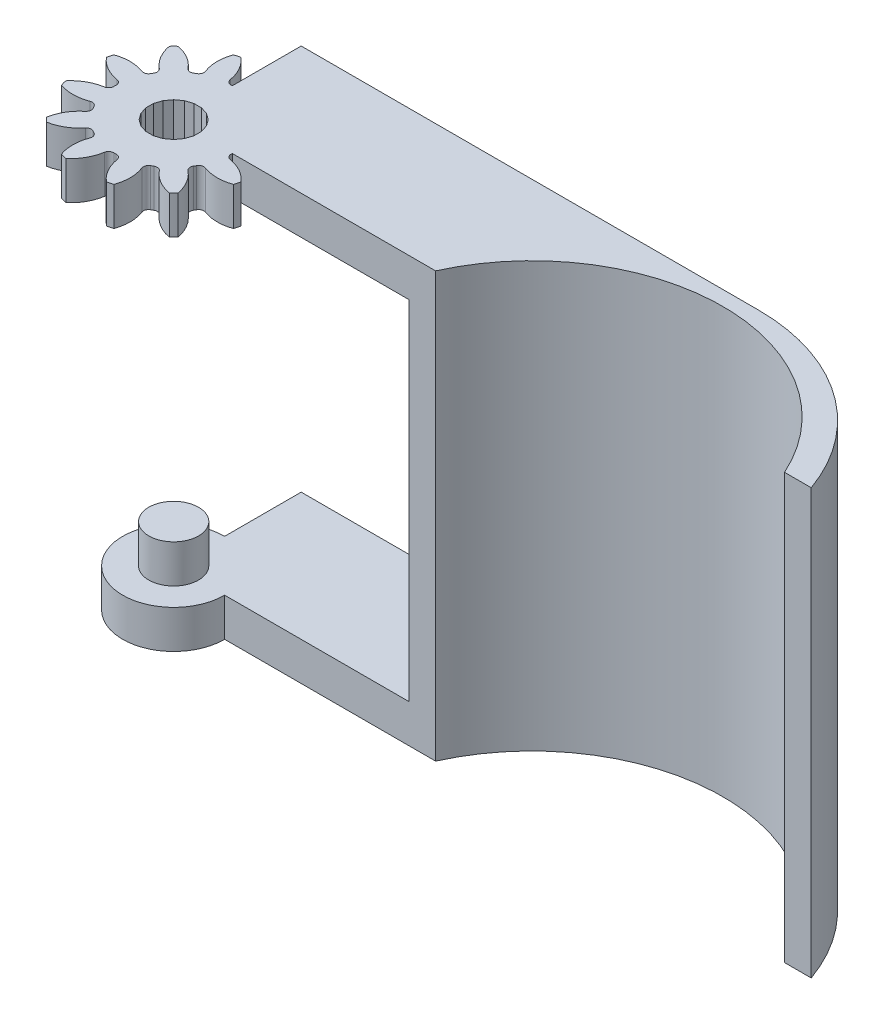
from build123d import *

# Parameters (mm, degrees)
SKETCH1_W           = 50
SKETCH1_H           = 10
BOSS_EXTRUDE2_DEPTH = 16.65
CUT_EXTRUDE1_START  = -27.3
SKETCH2_R           = 18.45
CUT_EXTRUDE1_DEPTH  = 27.3
SKETCH3_R           = 4
BOSS_EXTRUDE3_DEPTH = 3
CUT_EXTRUDE2_DEPTH  = 3
BOSS_EXTRUDE4_START = 3
SKETCH5_R           = 4
BOSS_EXTRUDE4_DEPTH = 3
SKETCH6_R           = 1.95
BOSS_EXTRUDE5_DEPTH = 3
BOSS_EXTRUDE6_DEPTH = 3
SKETCH9_R           = 3.38
SKETCH9_R_2         = 2.98
CUT_EXTRUDE3_DEPTH  = 1
SKETCH10_R          = 15
CUT_EXTRUDE4_DEPTH  = 61.900656811
FILLET1_R           = 15


with BuildPart() as part:
    # Sketch1 → Boss-Extrude2 (new, symmetric)
    with BuildSketch(Plane(origin=(0, 0, 0), x_dir=(1, 0, 0), z_dir=(0, 1, 0))):
        with Locations((25, 5)):
            Rectangle(SKETCH1_W, SKETCH1_H)
    extrude(amount=BOSS_EXTRUDE2_DEPTH, both=True)

    # Sketch2 → Cut-Extrude1 (cut)
    with BuildSketch(Plane(origin=(0, 13.65, 0), x_dir=(1, 0, 0), z_dir=(0, 1, 0)).offset(CUT_EXTRUDE1_START)):
        Circle(SKETCH2_R)
    extrude(amount=CUT_EXTRUDE1_DEPTH, mode=Mode.SUBTRACT)

    # Sketch3 → Boss-Extrude3 (add)
    with BuildSketch(Plane(origin=(0, 13.65, 0), x_dir=(1, 0, 0), z_dir=(0, 1, 0))):
        Circle(SKETCH3_R)
    extrude(amount=BOSS_EXTRUDE3_DEPTH)

    # Sketch4 → Cut-Extrude2 (cut)
    with BuildSketch(Plane.XZ.offset(-13.65)):
        Polygon((0.869391807, 1.706277494), (0.299572001, 1.891423172), (-0.299572001, 1.891423172), (-0.869391807, 1.706277494), (-1.354109486, 1.354109486), (-1.706277494, 0.869391807), (-1.891423172, 0.299572001), (-1.891423172, -0.299572001), (-1.706277494, -0.869391807), (-1.354109486, -1.354109486), (-0.869391807, -1.706277494), (-0.299572001, -1.891423172), (0.299572001, -1.891423172), (0.869391807, -1.706277494), (1.354109486, -1.354109486), (1.706277494, -0.869391807), (1.891423172, -0.299572001), (1.891423172, 0.299572001), (1.706277494, 0.869391807), (1.354109486, 1.354109486), align=None)
    extrude(amount=-CUT_EXTRUDE2_DEPTH, mode=Mode.SUBTRACT)

    # Sketch5 → Boss-Extrude4 (add)
    with BuildSketch(Plane(origin=(0, -13.65, 0), x_dir=(-1, 0, 0), z_dir=(0, -1, 0)).offset(BOSS_EXTRUDE4_START)):
        Circle(SKETCH5_R)
    extrude(amount=-BOSS_EXTRUDE4_DEPTH)

    # Sketch6 → Boss-Extrude5 (add)
    with BuildSketch(Plane(origin=(0, -13.65, 0), x_dir=(1, 0, 0), z_dir=(0, 1, 0))):
        with Locations(Location((0, 0, 0), (0, 0, 90))):
            Circle(SKETCH6_R)
    extrude(amount=BOSS_EXTRUDE5_DEPTH)

    # Sketch7 → Boss-Extrude6 (add)
    with BuildSketch(Plane(origin=(0, 16.65, 0), x_dir=(1, 0, 0), z_dir=(0, 1, 0))):
        with BuildLine():
            ThreePointArc((2.037195172, -4.526756305), (2.035703314, -4.242437448), (2.220911486, -4.026712227))
            ThreePointArc((2.220911486, -4.026712227), (2.299285714, -3.982479678), (2.376779339, -3.93672188))
            ThreePointArc((2.376779339, -3.93672188), (2.656206947, -3.884189508), (2.901688371, -4.027640924))
            ThreePointArc((2.901688371, -4.027640924), (3.755891391, -4.760966743), (4.811166064, -5.153171946))
            ThreePointArc((4.811166064, -5.153171946), (4.985102807, -4.985102807), (5.153171946, -4.811166064))
            ThreePointArc((5.153171946, -4.811166064), (4.760966743, -3.755891391), (4.027640924, -2.901688371))
            ThreePointArc((4.027640924, -2.901688371), (3.884189508, -2.656206947), (3.93672188, -2.376779339))
            ThreePointArc((3.93672188, -2.376779339), (3.982479678, -2.299285714), (4.026712227, -2.220911486))
            ThreePointArc((4.026712227, -2.220911486), (4.242437448, -2.035703314), (4.526756305, -2.037195172))
            ThreePointArc((4.526756305, -2.037195172), (5.63318073, -2.24517245), (6.743178006, -2.057194784))
            ThreePointArc((6.743178006, -2.057194784), (6.809777075, -1.824674268), (6.868360847, -1.59000606))
            ThreePointArc((6.868360847, -1.59000606), (6.001063841, -0.872213987), (4.938883542, -0.499115381))
            ThreePointArc((4.938883542, -0.499115381), (4.69191026, -0.35824794), (4.597690825, -0.089990347))
            ThreePointArc((4.597690825, -0.089990347), (4.598571429, 0), (4.597690825, 0.089990347))
            ThreePointArc((4.597690825, 0.089990347), (4.69191026, 0.35824794), (4.938883542, 0.499115381))
            ThreePointArc((4.938883542, 0.499115381), (6.001063841, 0.872213987), (6.868360847, 1.59000606))
            ThreePointArc((6.868360847, 1.59000606), (6.809777075, 1.824674268), (6.743178006, 2.057194784))
            ThreePointArc((6.743178006, 2.057194784), (5.63318073, 2.24517245), (4.526756305, 2.037195172))
            ThreePointArc((4.526756305, 2.037195172), (4.242437448, 2.035703314), (4.026712227, 2.220911486))
            ThreePointArc((4.026712227, 2.220911486), (3.982479678, 2.299285714), (3.93672188, 2.376779339))
            ThreePointArc((3.93672188, 2.376779339), (3.884189508, 2.656206947), (4.027640924, 2.901688371))
            ThreePointArc((4.027640924, 2.901688371), (4.760966743, 3.755891391), (5.153171946, 4.811166064))
            ThreePointArc((5.153171946, 4.811166064), (4.985102807, 4.985102807), (4.811166064, 5.153171946))
            ThreePointArc((4.811166064, 5.153171946), (3.755891391, 4.760966743), (2.901688371, 4.027640924))
            ThreePointArc((2.901688371, 4.027640924), (2.656206947, 3.884189508), (2.376779339, 3.93672188))
            ThreePointArc((2.376779339, 3.93672188), (2.299285714, 3.982479678), (2.220911486, 4.026712227))
            ThreePointArc((2.220911486, 4.026712227), (2.035703314, 4.242437448), (2.037195172, 4.526756305))
            ThreePointArc((2.037195172, 4.526756305), (2.24517245, 5.63318073), (2.057194784, 6.743178006))
            ThreePointArc((2.057194784, 6.743178006), (1.824674268, 6.809777075), (1.59000606, 6.868360847))
            ThreePointArc((1.59000606, 6.868360847), (0.872213987, 6.001063841), (0.499115381, 4.938883542))
            ThreePointArc((0.499115381, 4.938883542), (0.35824794, 4.69191026), (0.089990347, 4.597690825))
            ThreePointArc((0.089990347, 4.597690825), (0, 4.598571429), (-0.089990347, 4.597690825))
            ThreePointArc((-0.089990347, 4.597690825), (-0.35824794, 4.69191026), (-0.499115381, 4.938883542))
            ThreePointArc((-0.499115381, 4.938883542), (-0.872213987, 6.001063841), (-1.59000606, 6.868360847))
            ThreePointArc((-1.59000606, 6.868360847), (-1.824674268, 6.809777075), (-2.057194784, 6.743178006))
            ThreePointArc((-2.057194784, 6.743178006), (-2.24517245, 5.63318073), (-2.037195172, 4.526756305))
            ThreePointArc((-2.037195172, 4.526756305), (-2.035703314, 4.242437448), (-2.220911486, 4.026712227))
            ThreePointArc((-2.220911486, 4.026712227), (-2.299285714, 3.982479678), (-2.376779339, 3.93672188))
            ThreePointArc((-2.376779339, 3.93672188), (-2.656206947, 3.884189508), (-2.901688371, 4.027640924))
            ThreePointArc((-2.901688371, 4.027640924), (-3.755891391, 4.760966743), (-4.811166064, 5.153171946))
            ThreePointArc((-4.811166064, 5.153171946), (-4.985102807, 4.985102807), (-5.153171946, 4.811166064))
            ThreePointArc((-5.153171946, 4.811166064), (-4.760966743, 3.755891391), (-4.027640924, 2.901688371))
            ThreePointArc((-4.027640924, 2.901688371), (-3.884189508, 2.656206947), (-3.93672188, 2.376779339))
            ThreePointArc((-3.93672188, 2.376779339), (-3.982479678, 2.299285714), (-4.026712227, 2.220911486))
            ThreePointArc((-4.026712227, 2.220911486), (-4.242437448, 2.035703314), (-4.526756305, 2.037195172))
            ThreePointArc((-4.526756305, 2.037195172), (-5.63318073, 2.24517245), (-6.743178006, 2.057194784))
            ThreePointArc((-6.743178006, 2.057194784), (-6.809777075, 1.824674268), (-6.868360847, 1.59000606))
            ThreePointArc((-6.868360847, 1.59000606), (-6.001063841, 0.872213987), (-4.938883542, 0.499115381))
            ThreePointArc((-4.938883542, 0.499115381), (-4.69191026, 0.35824794), (-4.597690825, 0.089990347))
            ThreePointArc((-4.597690825, 0.089990347), (-4.598571429, 0), (-4.597690825, -0.089990347))
            ThreePointArc((-4.597690825, -0.089990347), (-4.69191026, -0.35824794), (-4.938883542, -0.499115381))
            ThreePointArc((-4.938883542, -0.499115381), (-6.001063841, -0.872213987), (-6.868360847, -1.59000606))
            ThreePointArc((-6.868360847, -1.59000606), (-6.809777075, -1.824674268), (-6.743178006, -2.057194784))
            ThreePointArc((-6.743178006, -2.057194784), (-5.63318073, -2.24517245), (-4.526756305, -2.037195172))
            ThreePointArc((-4.526756305, -2.037195172), (-4.242437448, -2.035703314), (-4.026712227, -2.220911486))
            ThreePointArc((-4.026712227, -2.220911486), (-3.982479678, -2.299285714), (-3.93672188, -2.376779339))
            ThreePointArc((-3.93672188, -2.376779339), (-3.884189508, -2.656206947), (-4.027640924, -2.901688371))
            ThreePointArc((-4.027640924, -2.901688371), (-4.760966743, -3.755891391), (-5.153171946, -4.811166064))
            ThreePointArc((-5.153171946, -4.811166064), (-4.985102807, -4.985102807), (-4.811166064, -5.153171946))
            ThreePointArc((-4.811166064, -5.153171946), (-3.755891391, -4.760966743), (-2.901688371, -4.027640924))
            ThreePointArc((-2.901688371, -4.027640924), (-2.656206947, -3.884189508), (-2.376779339, -3.93672188))
            ThreePointArc((-2.376779339, -3.93672188), (-2.299285714, -3.982479678), (-2.220911486, -4.026712227))
            ThreePointArc((-2.220911486, -4.026712227), (-2.035703314, -4.242437448), (-2.037195172, -4.526756305))
            ThreePointArc((-2.037195172, -4.526756305), (-2.24517245, -5.63318073), (-2.057194784, -6.743178006))
            ThreePointArc((-2.057194784, -6.743178006), (-1.824674268, -6.809777075), (-1.59000606, -6.868360847))
            ThreePointArc((-1.59000606, -6.868360847), (-0.872213987, -6.001063841), (-0.499115381, -4.938883542))
            ThreePointArc((-0.499115381, -4.938883542), (-0.35824794, -4.69191026), (-0.089990347, -4.597690825))
            ThreePointArc((-0.089990347, -4.597690825), (0, -4.598571429), (0.089990347, -4.597690825))
            ThreePointArc((0.089990347, -4.597690825), (0.35824794, -4.69191026), (0.499115381, -4.938883542))
            ThreePointArc((0.499115381, -4.938883542), (0.872213987, -6.001063841), (1.59000606, -6.868360847))
            ThreePointArc((1.59000606, -6.868360847), (1.824674268, -6.809777075), (2.057194784, -6.743178006))
            ThreePointArc((2.057194784, -6.743178006), (2.24517245, -5.63318073), (2.037195172, -4.526756305))
        make_face()
        Polygon((1.706277494, -0.869391807), (1.354109486, -1.354109486), (0.869391807, -1.706277494), (0.299572001, -1.891423172), (-0.299572001, -1.891423172), (-0.869391807, -1.706277494), (-1.354109486, -1.354109486), (-1.706277494, -0.869391807), (-1.891423172, -0.299572001), (-1.891423172, 0.299572001), (-1.706277494, 0.869391807), (-1.354109486, 1.354109486), (-0.869391807, 1.706277494), (-0.299572001, 1.891423172), (0.299572001, 1.891423172), (0.869391807, 1.706277494), (1.354109486, 1.354109486), (1.706277494, 0.869391807), (1.891423172, 0.299572001), (1.891423172, -0.299572001), align=None, mode=Mode.SUBTRACT)
    extrude(amount=-BOSS_EXTRUDE6_DEPTH)

    # Sketch9 → Cut-Extrude3 (cut)
    with BuildSketch(Plane.XZ.offset(-13.65)):
        with Locations(Location((0, 0, 0), (0, 0, 270))):
            Circle(SKETCH9_R)
        with Locations(Location((0, 0, 0), (0, 0, 270))):
            Circle(SKETCH9_R_2, mode=Mode.SUBTRACT)
    extrude(amount=-CUT_EXTRUDE3_DEPTH, mode=Mode.SUBTRACT)

    # Sketch10 → Cut-Extrude4 (cut, through all)
    with BuildSketch(Plane(origin=(0, 16.65, 0), x_dir=(1, 0, 0), z_dir=(0, 1, 0))):
        with Locations((34.225, -6.15)):
            Circle(SKETCH10_R)
    extrude(amount=-CUT_EXTRUDE4_DEPTH, mode=Mode.SUBTRACT)

    # Fillet1
    # the kernel refuses this fillet: 15 mm, written as the material it takes off along each edge
    with BuildSketch(Plane(origin=(50, -52.005339059, -10), x_dir=(-1, 0, 0), z_dir=(0, 1, 0))) as fillet1_piece_1:
        with BuildLine():
            CenterArc((14.142135624, 15), FILLET1_R, 199.471220634, 70.528779366)
            Line((0, 10), (-0.282842712, 9.9))
            ThreePointArc((-0.282842712, 9.9), (-0.3, 5), (-0.3, 0))
            Line((-0.3, 0), (0, -0.3))
            Line((0, -0.3), (14.142135624, -0.3))
            Line((14.142135624, -0.3), (14.142135624, 0))
        make_face()
    extrude(amount=104.010678119, mode=Mode.SUBTRACT)


solid = part.part
